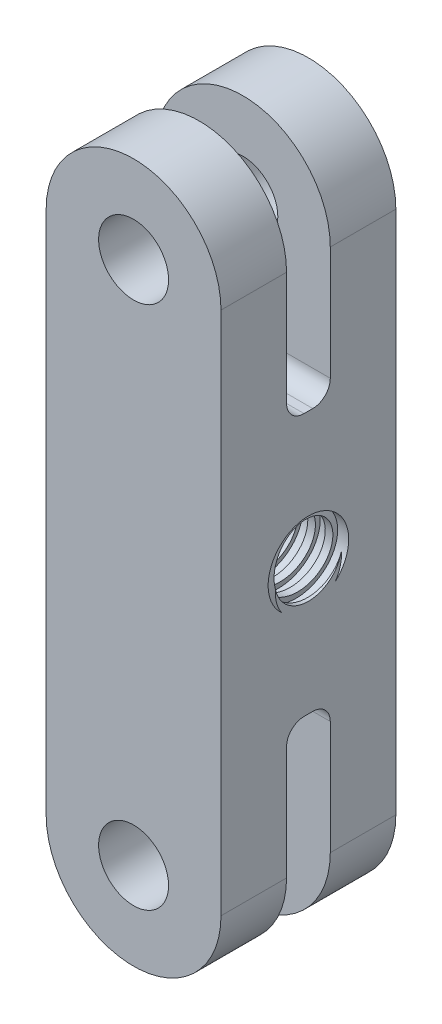
from build123d import *

# Parameters (mm, degrees)
SKETCH1_R           = 4
BOSS_EXTRUDE1_DEPTH = 20
SKETCH2_R           = 3.85
SKETCH2_W           = 5
SKETCH2_H           = 30
CUT_EXTRUDE1_DEPTH  = 76.498344353
FILLET1_R           = 2
CUT_SWEEP1_PITCH    = 2


with BuildPart() as part:
    # Sketch1 → Boss-Extrude1 (new body)
    with BuildSketch(Plane.XY):
        with BuildLine():
            Line((-10, 60), (-10, 0))
            ThreePointArc((-10, 0), (0, -10), (10, 0))
            Line((10, 0), (10, 60))
            ThreePointArc((10, 60), (0, 70), (-10, 60))
        make_face()
        Circle(SKETCH1_R, mode=Mode.SUBTRACT)
        with Locations((0, 60)):
            Circle(SKETCH1_R, mode=Mode.SUBTRACT)
    extrude(amount=-BOSS_EXTRUDE1_DEPTH)

    # Sketch2 → Cut-Extrude1 (cut, through all)
    with BuildSketch(Plane.ZY.offset(10)):
        with Locations((-10, 30)):
            Circle(SKETCH2_R)
        with Locations((-10, 60)):
            Rectangle(SKETCH2_W, SKETCH2_H)
        with Locations((-10, 0)):
            Rectangle(SKETCH2_W, SKETCH2_H)
    extrude(amount=-CUT_EXTRUDE1_DEPTH, mode=Mode.SUBTRACT)

    # Fillet1
    fillet1_edges = [part.edges().sort_by_distance(p)[0] for p in [
        (0, 45, -12.5),
        (0, 45, -7.5),
        (0, 15, -7.5),
        (0, 15, -12.5),
    ]]
    fillet(fillet1_edges, radius=FILLET1_R)

    # Cut-Sweep1: arcs per turn and ends read off the stored shape
    # Cut-Sweep1: the profile of Sketch9 screwed along a right-hand helix through 20 turns, 10 arcs to a turn; built about Z, then put on its axis
    cut_sweep1_z = Axis((0, 0, 0), (0, 0, 1))
    cut_sweep1_corners = [(3.605662433, -6.29e-07, 1.249999944), (4.605662433, -8.04e-07, 1.517949137), (4.605662433, -8.04e-07, -0.017949248), (3.605662433, -6.29e-07, 0.249999944)]
    with BuildLine(mode=Mode.PRIVATE) as cut_sweep1_profile:
        Line(cut_sweep1_corners[0], cut_sweep1_corners[1])
        Line(cut_sweep1_corners[1], cut_sweep1_corners[2])
        Line(cut_sweep1_corners[2], cut_sweep1_corners[3])
        Line(cut_sweep1_corners[3], cut_sweep1_corners[0])
    cut_sweep1_cap = Face(cut_sweep1_profile.wire())
    cut_sweep1_turn_angles = [0, 18, 36, 54, 72, 90, 108, 126, 144, 162, 180, 198, 216, 234, 252, 270, 288, 306, 324, 342, 360]
    cut_sweep1_turn_weights = [1, 0.9510565162951535, 1, 0.9510565162951535, 1, 0.9510565162951535, 1, 0.9510565162951535, 1, 0.9510565162951535, 1, 0.9510565162951535, 1, 0.9510565162951535, 1, 0.9510565162951535, 1, 0.9510565162951535, 1, 0.9510565162951535, 1]
    cut_sweep1_turn_rails = [Edge.make_bspline([Vector(p[0], p[1], 0).rotate(cut_sweep1_z, cut_sweep1_turn_angles[k]) / cut_sweep1_turn_weights[k] + Vector(0, 0, p[2] + CUT_SWEEP1_PITCH * cut_sweep1_turn_angles[k] / 360) for k in range(21)], [0, 0, 0, 1, 1, 2, 2, 3, 3, 4, 4, 5, 5, 6, 6, 7, 7, 8, 8, 9, 9, 10, 10, 10], 2, cut_sweep1_turn_weights) for p in cut_sweep1_corners]
    cut_sweep1_turn_sides = [Face.make_surface_from_curves(cut_sweep1_turn_rails[p[0]], cut_sweep1_turn_rails[p[1]]) for p in [(0, 1), (1, 2), (2, 3), (3, 0)]]
    cut_sweep1 = Plane(origin=(14.75, 30, -10), x_dir=(0, 1, 0), z_dir=(-1, 0, 0)) * Solid(Shell([*[p.moved(Location((0, 0, CUT_SWEEP1_PITCH * i))) for i in range(20) for p in cut_sweep1_turn_sides], cut_sweep1_cap, cut_sweep1_cap.rotate(cut_sweep1_z, 7200).moved(Location((0, 0, CUT_SWEEP1_PITCH * 7200 / 360)))]))
    add(cut_sweep1, mode=Mode.SUBTRACT)


solid = part.part
